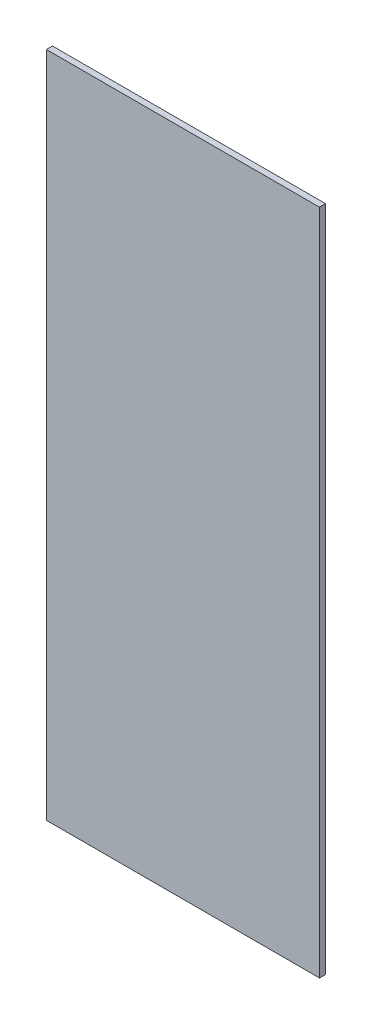
from build123d import *

# Parameters (mm, degrees)
SKETCH1_W           = 90
SKETCH1_H           = 220
BOSS_EXTRUDE1_DEPTH = 2


with BuildPart() as part:
    # Sketch1 → Boss-Extrude1 (new body)
    with BuildSketch(Plane.XY):
        Rectangle(SKETCH1_W, SKETCH1_H)
    extrude(amount=BOSS_EXTRUDE1_DEPTH)


solid = part.part
